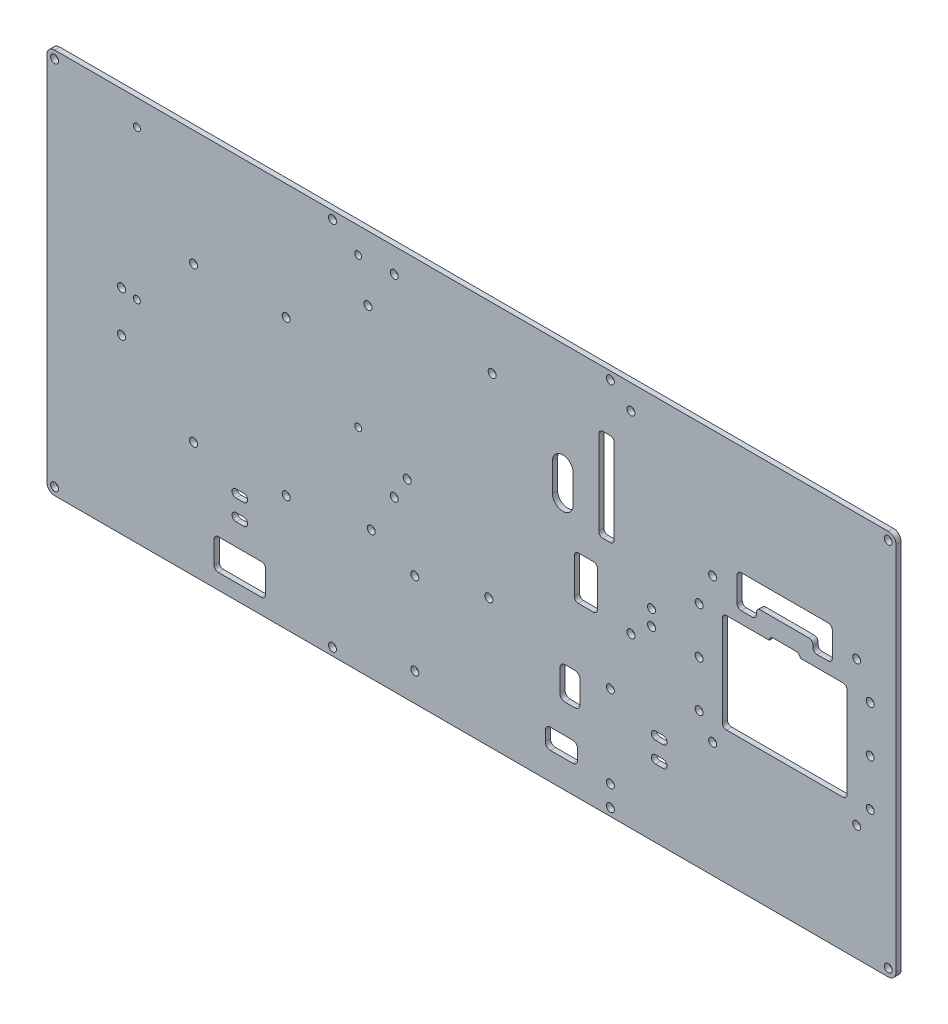
from build123d import *

# Parameters (mm, degrees)
SKETCH1_W                  = 330
SKETCH1_H                  = 150
SKETCH1_R                  = 1.55
SKETCH1_W_2                = 20
SKETCH1_H_2                = 12
SKETCH1_W_3                = 9
SKETCH1_H_3                = 17
SKETCH1_W_4                = 6
SKETCH1_H_4                = 36
BOSS_EXTRUDE1_DEPTH        = 2
FILLET1_R                  = 3
FILLET2_R                  = 1.6
SKETCH4_R                  = 1.35
JETSON_NANO_DEPTH          = 10
SKETCH5_R                  = 1.55
DCDC19V_AND_MOAB_DEPTH     = 10
SKETCH6_W                  = 12.6
SKETCH6_H                  = 7.8
SKETCH6_W_2                = 7.8
SKETCH6_H_2                = 12.6
SKETCH6_R                  = 1.55
DCDC_5V10A_CASE_HOLE_DEPTH = 10
FILLET3_R                  = 2
WIRING_TIDE_HOLE_DEPTH     = 10


with BuildPart() as part:
    # Sketch1 → Boss-Extrude1 (new body)
    with BuildSketch(Plane.XY):
        Rectangle(SKETCH1_W, SKETCH1_H)
        with Locations((-162, -72)):
            Circle(SKETCH1_R, mode=Mode.SUBTRACT)
        with Locations((-90, -63)):
            Rectangle(SKETCH1_W_2, SKETCH1_H_2, mode=Mode.SUBTRACT)
        with Locations((-54, -72)):
            Circle(SKETCH1_R, mode=Mode.SUBTRACT)
        with Locations((-136, -8)):
            Circle(SKETCH1_R, mode=Mode.SUBTRACT)
        with Locations((-30, -9.5)):
            Circle(SKETCH1_R, mode=Mode.SUBTRACT)
        with Locations((54, -72)):
            Circle(SKETCH1_R, mode=Mode.SUBTRACT)
        with Locations((162, -72)):
            Circle(SKETCH1_R, mode=Mode.SUBTRACT)
        with Locations((62, -9.5)):
            Circle(SKETCH1_R, mode=Mode.SUBTRACT)
        with Locations((44.5, -1)):
            Rectangle(SKETCH1_W_3, SKETCH1_H_3, mode=Mode.SUBTRACT)
        with Locations((70, -3)):
            Circle(SKETCH1_R, mode=Mode.SUBTRACT)
        with Locations((93.75, -30.1)):
            Circle(SKETCH1_R, mode=Mode.SUBTRACT)
        with Locations((88.5, -22.1)):
            Circle(SKETCH1_R, mode=Mode.SUBTRACT)
        with Locations((149.75, -30.1)):
            Circle(SKETCH1_R, mode=Mode.SUBTRACT)
        with Locations((155, -22.1)):
            Circle(SKETCH1_R, mode=Mode.SUBTRACT)
        with Locations((88.5, -4.1)):
            Circle(SKETCH1_R, mode=Mode.SUBTRACT)
        Polygon((97.5, -23.3), (97.5, 15.2), (115.75, 15.2), (115.75, 16.7), (127.75, 16.7), (127.75, 15.2), (146, 15.2), (146, -23.3), align=None, mode=Mode.SUBTRACT)
        with Locations((155, -4.1)):
            Circle(SKETCH1_R, mode=Mode.SUBTRACT)
        with Locations((-136, 8)):
            Circle(SKETCH1_R, mode=Mode.SUBTRACT)
        with Locations((-162, 72)):
            Circle(SKETCH1_R, mode=Mode.SUBTRACT)
        with Locations((-54, 72)):
            Circle(SKETCH1_R, mode=Mode.SUBTRACT)
        with Locations((-30, 65.5)):
            Circle(SKETCH1_R, mode=Mode.SUBTRACT)
        with Locations((70, 3)):
            Circle(SKETCH1_R, mode=Mode.SUBTRACT)
        with BuildLine():
            ThreePointArc((39.5, 22.5), (35.5, 18.5), (31.5, 22.5))
            Line((31.5, 22.5), (31.5, 33.5))
            ThreePointArc((31.5, 33.5), (35.5, 37.5), (39.5, 33.5))
            Line((39.5, 33.5), (39.5, 22.5))
        make_face(mode=Mode.SUBTRACT)
        with Locations((52.5, 35.2)):
            Rectangle(SKETCH1_W_4, SKETCH1_H_4, mode=Mode.SUBTRACT)
        with Locations((88.5, 13.9)):
            Circle(SKETCH1_R, mode=Mode.SUBTRACT)
        with Locations((155, 13.9)):
            Circle(SKETCH1_R, mode=Mode.SUBTRACT)
        with Locations((93.75, 25.9)):
            Circle(SKETCH1_R, mode=Mode.SUBTRACT)
        Polygon((103.25, 19.7), (103.25, 32.5), (140.25, 32.5), (140.25, 19.7), (132.75, 19.7), (132.75, 23.7), (110.75, 23.7), (110.75, 19.7), align=None, mode=Mode.SUBTRACT)
        with Locations((149.75, 25.9)):
            Circle(SKETCH1_R, mode=Mode.SUBTRACT)
        with Locations((54, 72)):
            Circle(SKETCH1_R, mode=Mode.SUBTRACT)
        with Locations((62, 65.5)):
            Circle(SKETCH1_R, mode=Mode.SUBTRACT)
        with Locations((162, 72)):
            Circle(SKETCH1_R, mode=Mode.SUBTRACT)
    extrude(amount=BOSS_EXTRUDE1_DEPTH)

    # Fillet1
    fillet1_edges = [part.edges().sort_by_distance(p)[0] for p in [
        (-165, 75, 1),
        (165, 75, 1),
        (165, -75, 1),
        (-165, -75, 1),
    ]]
    fillet(fillet1_edges, radius=FILLET1_R)

    # Fillet2
    # the kernel refuses this fillet: 1.6 mm, written as the material it adds along each edge
    with BuildSketch(Plane(origin=(40, 7.5, 0), x_dir=(1, 0, 0), z_dir=(0, 0, 1)), Plane(origin=(55.5, 53.2, 0), x_dir=(0, -1, 0), z_dir=(0, 0, 1)), Plane(origin=(103.25, 19.7, 0), x_dir=(0, 1, 0), z_dir=(0, 0, 1)), Plane(origin=(-80, -57, 0), x_dir=(0, -1, 0), z_dir=(0, 0, 1)), Plane(origin=(97.5, -23.3, 0), x_dir=(0, 1, 0), z_dir=(0, 0, 1))) as fillet2_piece_1:
        with BuildLine():
            CenterArc((FILLET2_R, -FILLET2_R), FILLET2_R, 90, 90)
            Line((0, -FILLET2_R), (0, 0))
            Line((0, 0), (FILLET2_R, 0))
        make_face()
    extrude(amount=2)
    with BuildSketch(Plane(origin=(40, -9.5, 0), x_dir=(1, 0, 0), z_dir=(0, 0, 1)), Plane(origin=(49, -9.5, 0), x_dir=(0, 1, 0), z_dir=(0, 0, 1)), Plane(origin=(49, 7.5, 0), x_dir=(-1, 0, 0), z_dir=(0, 0, 1)), Plane(origin=(49.5, 17.2, 0), x_dir=(1, 0, 0), z_dir=(0, 0, 1)), Plane(origin=(55.5, 17.2, 0), x_dir=(0, 1, 0), z_dir=(0, 0, 1)), Plane(origin=(49.5, 53.2, 0), x_dir=(0, -1, 0), z_dir=(0, 0, 1)), Plane(origin=(103.25, 32.5, 0), x_dir=(0, -1, 0), z_dir=(0, 0, 1)), Plane(origin=(110.75, 19.7, 0), x_dir=(0, 1, 0), z_dir=(0, 0, 1)), Plane(origin=(132.75, 19.7, 0), x_dir=(1, 0, 0), z_dir=(0, 0, 1)), Plane(origin=(140.25, 19.7, 0), x_dir=(0, 1, 0), z_dir=(0, 0, 1)), Plane(origin=(140.25, 32.5, 0), x_dir=(-1, 0, 0), z_dir=(0, 0, 1)), Plane(origin=(-80, -69, 0), x_dir=(0, 1, 0), z_dir=(0, 0, 1)), Plane(origin=(-100, -57, 0), x_dir=(0, -1, 0), z_dir=(0, 0, 1)), Plane(origin=(-100, -69, 0), x_dir=(1, 0, 0), z_dir=(0, 0, 1)), Plane(origin=(97.5, 15.2, 0), x_dir=(0, -1, 0), z_dir=(0, 0, 1)), Plane(origin=(146, -23.3, 0), x_dir=(0, 1, 0), z_dir=(0, 0, 1)), Plane(origin=(146, 15.2, 0), x_dir=(-1, 0, 0), z_dir=(0, 0, 1))) as fillet2_piece_2:
        with BuildLine():
            CenterArc((FILLET2_R, FILLET2_R), FILLET2_R, 180, 90)
            Line((0, FILLET2_R), (0, 0))
            Line((0, 0), (FILLET2_R, 0))
        make_face()
    extrude(amount=2)
    with BuildSketch(Plane(origin=(115.75, 16.7, 0), x_dir=(0, -1, 0), z_dir=(0, 0, 1))) as fillet2_piece_3:
        with BuildLine():
            CenterArc((1.6, 1.596871942), FILLET2_R, 180, 86.416678302)
            Line((0, 1.596871942), (0, 0))
            Line((0, 0), (1.5, 0))
        make_face()
    extrude(amount=2)
    with BuildSketch(Plane(origin=(127.75, 16.7, 0), x_dir=(-1, 0, 0), z_dir=(0, 0, 1))) as fillet2_piece_4:
        with BuildLine():
            CenterArc((1.596871942, 1.6), FILLET2_R, 183.583321698, 86.416678302)
            Line((0, 1.5), (0, 0))
            Line((0, 0), (1.596871942, 0))
        make_face()
    extrude(amount=2)
    # the kernel refuses this fillet: 1.6 mm, written as the material it takes off along each edge
    with BuildSketch(Plane(origin=(110.75, 23.7, -4), x_dir=(1, 0, 0), z_dir=(0, 0, 1)), Plane(origin=(132.75, 23.7, -4), x_dir=(0, -1, 0), z_dir=(0, 0, 1))) as fillet2_2_piece_1:
        with BuildLine():
            CenterArc((FILLET2_R, -FILLET2_R), FILLET2_R, 90, 90)
            Line((0, -FILLET2_R), (0, 0))
            Line((0, 0), (FILLET2_R, 0))
        make_face()
    extrude(amount=10, mode=Mode.SUBTRACT)

    # Sketch4 → Jetson nano (cut)
    with BuildSketch(Plane.XY.offset(2)):
        with Locations((-130, 65)):
            Circle(SKETCH4_R)
        with Locations((-44, 65)):
            Circle(SKETCH4_R)
        with Locations((-130, 7)):
            Circle(SKETCH4_R)
        with Locations((-44, 7)):
            Circle(SKETCH4_R)
    extrude(amount=-JETSON_NANO_DEPTH, mode=Mode.SUBTRACT)

    # Sketch5 → DCDC19V and MOAB (cut)
    with BuildSketch(Plane.XY.offset(2)):
        with Locations((-107.999998979, -30.000000613)):
            Circle(SKETCH5_R)
        with Locations((-108.000001021, 29.999999387)):
            Circle(SKETCH5_R)
        with Locations((-71.999998979, -29.999999387)):
            Circle(SKETCH5_R)
        with Locations((-72.000001021, 30.000000613)):
            Circle(SKETCH5_R)
        with Locations((-38.929421978, -25)):
            Circle(SKETCH5_R)
        with Locations((6.790578022, -25)):
            Circle(SKETCH5_R)
        with Locations((-24.959421978, -0.93)):
            Circle(SKETCH5_R)
        with Locations((-40.199421978, 49.87)):
            Circle(SKETCH5_R)
        with Locations((8.060578022, 51.17)):
            Circle(SKETCH5_R)
    extrude(amount=-DCDC19V_AND_MOAB_DEPTH, mode=Mode.SUBTRACT)

    # Sketch6 → DCDC 5V10A case hole (cut)
    # profile 1 of 7: a face of its own
    with BuildSketch(Plane.XY.offset(2)):
        with Locations((35, -60.5)):
            Rectangle(SKETCH6_W, SKETCH6_H)
        with BuildLine():
            ThreePointArc((38, -63), (40.5, -60.5), (38, -58))
            Line((38, -58), (32, -58))
            ThreePointArc((32, -58), (29.5, -60.5), (32, -63))
            Line((32, -63), (38, -63))
        make_face(mode=Mode.SUBTRACT)
    # profile 2 of 7: a face of its own
    with BuildSketch(Plane.XY.offset(2)):
        with BuildLine():
            Line((32, -63), (38, -63))
            ThreePointArc((38, -63), (40.5, -60.5), (38, -58))
            Line((38, -58), (32, -58))
            ThreePointArc((32, -58), (29.5, -60.5), (32, -63))
        make_face()
    # profile 3 of 7: a face of its own
    with BuildSketch(Plane.XY.offset(2)):
        with Locations((38.3, -39)):
            Rectangle(SKETCH6_W_2, SKETCH6_H_2)
    # profile 4 of 7: a face of its own
    with BuildSketch(Plane.XY.offset(2)):
        with Locations((54, -32)):
            Circle(SKETCH6_R)
    # profile 5 of 7: a face of its own
    with BuildSketch(Plane.XY.offset(2)):
        with Locations((54, -64)):
            Circle(SKETCH6_R)
    # profile 6 of 7: a face of its own
    with BuildSketch(Plane.XY.offset(2)):
        with Locations((-22, -64)):
            Circle(SKETCH6_R)
    # profile 7 of 7: a face of its own
    with BuildSketch(Plane.XY.offset(2)):
        with Locations((-22, -32)):
            Circle(SKETCH6_R)
    extrude(amount=-DCDC_5V10A_CASE_HOLE_DEPTH, mode=Mode.SUBTRACT)

    # Fillet3
    fillet3_edges = [part.edges().sort_by_distance(p)[0] for p in [
        (34.4, -32.7, 1),
        (42.2, -32.7, 1),
        (42.2, -45.3, 1),
        (34.4, -45.3, 1),
        (41.3, -56.6, 1),
        (41.3, -64.4, 1),
        (28.7, -64.4, 1),
        (28.7, -56.6, 1),
    ]]
    fillet(fillet3_edges, radius=FILLET3_R)

    # Sketch7 → wiring tide hole (cut)
    with BuildSketch(Plane.XY.offset(2)):
        with BuildLine():
            Line((-91.5, -37.45), (-88.5, -37.45))
            ThreePointArc((-88.5, -37.45), (-86.95, -39), (-88.5, -40.55))
            Line((-88.5, -40.55), (-91.5, -40.55))
            ThreePointArc((-91.5, -40.55), (-93.05, -39), (-91.5, -37.45))
        make_face()
        with BuildLine():
            Line((-91.5, -45.45), (-88.5, -45.45))
            ThreePointArc((-88.5, -45.45), (-86.95, -47), (-88.5, -48.55))
            Line((-88.5, -48.55), (-91.5, -48.55))
            ThreePointArc((-91.5, -48.55), (-93.05, -47), (-91.5, -45.45))
        make_face()
        with BuildLine():
            Line((71.5, -37.45), (74.5, -37.45))
            ThreePointArc((74.5, -37.45), (76.05, -39), (74.5, -40.55))
            Line((74.5, -40.55), (71.5, -40.55))
            ThreePointArc((71.5, -40.55), (69.95, -39), (71.5, -37.45))
        make_face()
        with BuildLine():
            Line((71.5, -45.45), (74.5, -45.45))
            ThreePointArc((74.5, -45.45), (76.05, -47), (74.5, -48.55))
            Line((74.5, -48.55), (71.5, -48.55))
            ThreePointArc((71.5, -48.55), (69.95, -47), (71.5, -45.45))
        make_face()
    extrude(amount=-WIRING_TIDE_HOLE_DEPTH, mode=Mode.SUBTRACT)


solid = part.part
